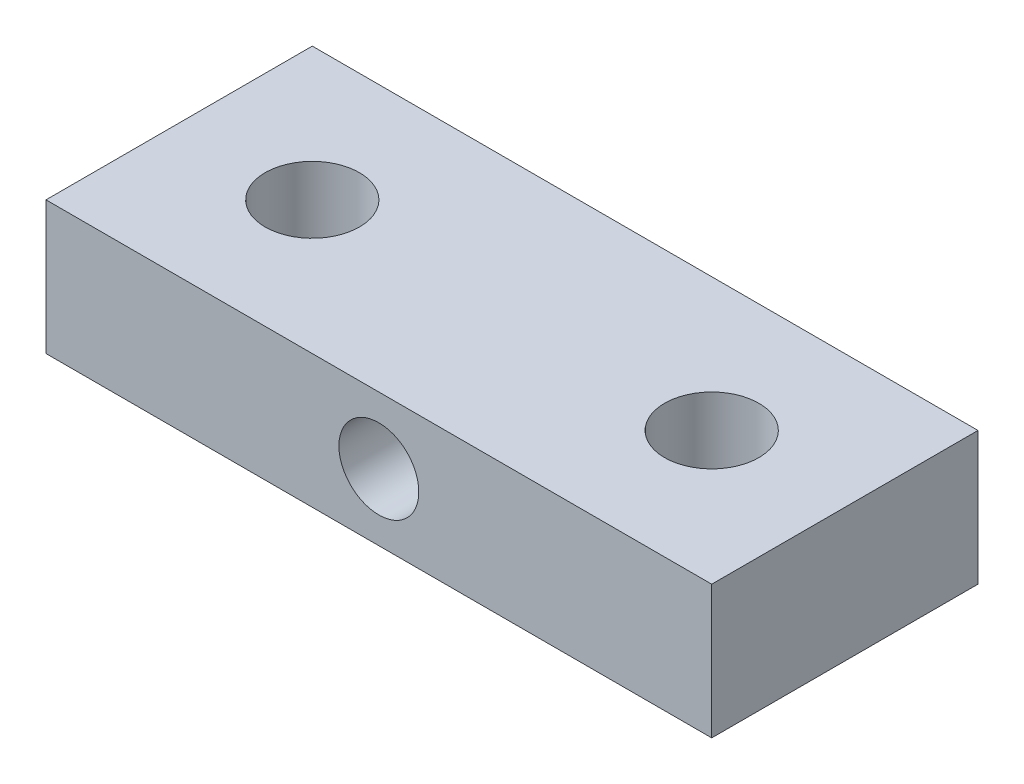
from build123d import *

# Parameters (mm, degrees)
SKETCH1_W             = 31.75
SKETCH1_H             = 12.7
BOSS_EXTRUDE1_DEPTH   = 6.35
SKETCH2_R             = 1.905
CUT_EXTRUDE1_DEPTH    = 22.298547486
F_8_CLEARANCE_HOLE1_D = 4.4958


with BuildPart() as part:
    # Sketch1 → Boss-Extrude1 (new body)
    with BuildSketch(Plane(origin=(0, 0, 0), x_dir=(1, 0, 0), z_dir=(0, 1, 0))):
        Rectangle(SKETCH1_W, SKETCH1_H)
    extrude(amount=BOSS_EXTRUDE1_DEPTH)

    # Sketch2 → Cut-Extrude1 (cut, through all)
    with BuildSketch(Plane(origin=(0, 0, -6.35), x_dir=(-1, 0, 0), z_dir=(0, 0, -1))):
        with Locations((0, 3.175)):
            Circle(SKETCH2_R)
    extrude(amount=-CUT_EXTRUDE1_DEPTH, mode=Mode.SUBTRACT)

    # #8 Clearance Hole1 (through all)
    with Locations(Plane(origin=(0, 6.35, 0), x_dir=(1, 0, 0), z_dir=(0, 1, 0))):
        with Locations((9.525, 0), (-9.525, 0)):
            Hole(F_8_CLEARANCE_HOLE1_D / 2)


solid = part.part
